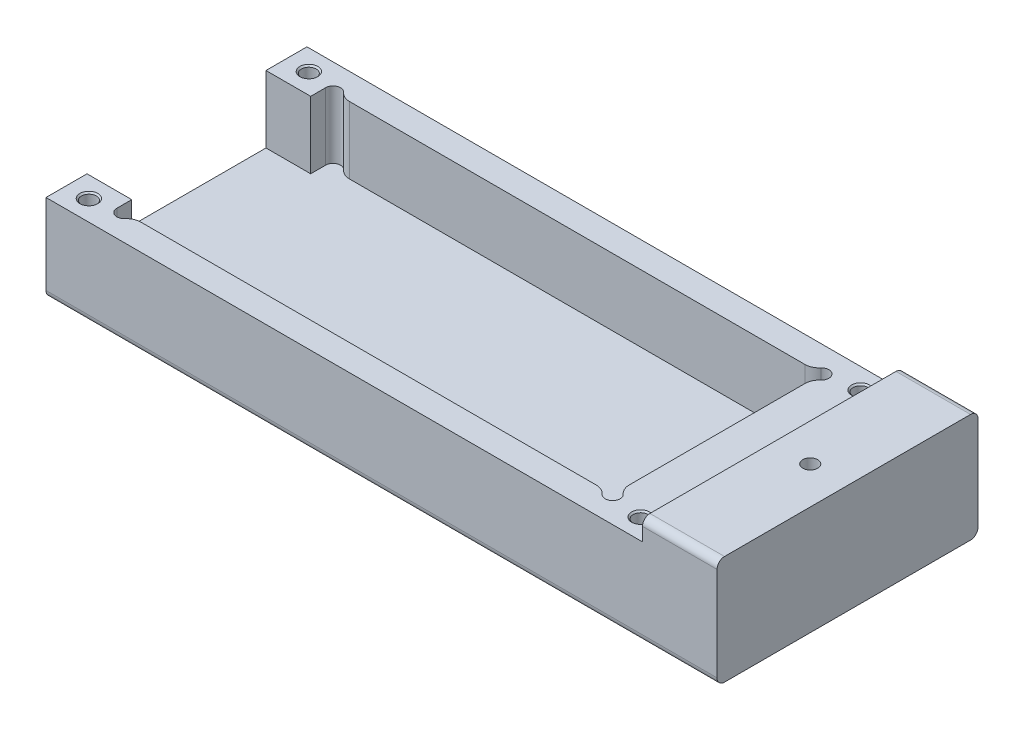
from build123d import *

# Parameters (mm, degrees)
SKETCH_1_W                 = 45
SKETCH_1_H                 = 17.5
EXTRUDE_2_DEPTH            = 5.9
CUT_EXTRUDE_1_DEPTH        = 10
CUT_EXTRUDE_1_DEPTH_BACK   = 2.4
FILLET_1_R                 = 1
FILLET_2_R                 = 1
FILLET_5_R                 = 1
FILLET_6_R                 = 1
FILLET_7_R                 = 0.5
SKETCH_5_R                 = 0.5
CUT_EXTRUDE_2_DEPTH        = 4.5
CHAMFER_1_SIZE             = 0.1
CHAMFER_1_OF_MIRROR_1_SIZE = 0.1
SKETCH_20_W                = 5
SKETCH_20_H                = 17.5
EXTRUDE_3_DEPTH            = 1.4
FILLET_8_R                 = 0.5
SKETCH_21_R                = 0.5
CUT_EXTRUDE_3_DEPTH        = 11


# Read off the part's stored shape, not the designer's step: 镜向2
with BuildPart() as part:
    # 草图1 → 凸台-拉伸2 (new body)
    with BuildSketch(Plane(origin=(0, 0, 0), x_dir=(1, 0, 0), z_dir=(0, 1, 0))):
        with Locations((2.5, 0)):
            Rectangle(SKETCH_1_W, SKETCH_1_H)
    extrude(amount=EXTRUDE_2_DEPTH)

    # 草图3 → 切除-拉伸1 (cut, two sides: drawn at the far end of the back side and taken through both)
    with BuildSketch(Plane(origin=(0, 3.8, 0), x_dir=(1, 0, 0), z_dir=(0, 1, 0)).offset(-CUT_EXTRUDE_1_DEPTH_BACK)):
        with BuildLine():
            Line((-17, -6.5), (-17, -7))
            ThreePointArc((-17, -7), (-16.5, -7.5), (-16, -7))
            Line((-16, -7), (15.751729614, -7))
            ThreePointArc((15.751729614, -7), (16.605283005, -7.353553391), (16.251729614, -6.5))
            Line((16.251729614, -6.5), (16.251729614, 6.5))
            ThreePointArc((16.251729614, 6.5), (16.605283005, 7.353553391), (15.751729614, 7))
            Line((15.751729614, 7), (-16, 7))
            ThreePointArc((-16, 7), (-16.5, 7.5), (-17, 7))
            Line((-17, 7), (-17, 6.5))
            Line((-17, 6.5), (-17, 6))
            Line((-17, 6), (-20, 6))
            Line((-20, 6), (-20, -6))
            Line((-20, -6), (-17, -6))
            Line((-17, -6), (-17, -6.5))
        make_face()
    extrude(amount=CUT_EXTRUDE_1_DEPTH + CUT_EXTRUDE_1_DEPTH_BACK, mode=Mode.SUBTRACT)

    # 圆角1
    fillet_1_edges = [part.edges().sort_by_distance(p)[0] for p in [
        (16.251729614, 3.65, -6.5),
    ]]
    fillet(fillet_1_edges, radius=FILLET_1_R)

    # 圆角2
    fillet_2_edges = [part.edges().sort_by_distance(p)[0] for p in [
        (15.751729614, 3.65, -7),
    ]]
    fillet(fillet_2_edges, radius=FILLET_2_R)

    # 圆角5
    fillet_5_edges = [part.edges().sort_by_distance(p)[0] for p in [
        (-16, 3.65, 7),
        (-16, 3.65, -7),
    ]]
    fillet(fillet_5_edges, radius=FILLET_5_R)

    # 圆角6
    fillet_6_edges = [part.edges().sort_by_distance(p)[0] for p in [
        (15.751729614, 3.65, 7),
        (16.251729614, 3.65, 6.5),
    ]]
    fillet(fillet_6_edges, radius=FILLET_6_R)

    # 圆角7
    fillet_7_edges = [part.edges().sort_by_distance(p)[0] for p in [
        (2.5, 0, -8.75),
        (2.5, 0, 8.75),
    ]]
    fillet(fillet_7_edges, radius=FILLET_7_R)

    # 草图5 → 切除-拉伸2 (cut)
    with BuildSketch(Plane(origin=(0, 5.9, 0), x_dir=(1, 0, 0), z_dir=(0, 1, 0))):
        with Locations(Location((-18.5, 7.375, 0), (0, 0, 270))):
            Circle(SKETCH_5_R)
    cut_extrude_2 = extrude(amount=-CUT_EXTRUDE_2_DEPTH, mode=Mode.SUBTRACT)

    # 倒角1
    chamfer_1_edges = [part.edges().sort_by_distance(p)[0] for p in [
        (-18.5, 5.9, -7.875),
    ]]
    chamfer(chamfer_1_edges, length=CHAMFER_1_SIZE)

    # 镜向1: 切除-拉伸2 across plane
    add(cut_extrude_2.mirror(Plane.XY), mode=Mode.SUBTRACT)

    # 倒角1 of 镜向1
    chamfer_1_of_mirror_1_edges = [part.edges().sort_by_distance(p)[0] for p in [
        (-18.5, 5.9, 7.875),
    ]]
    chamfer(chamfer_1_of_mirror_1_edges, length=CHAMFER_1_OF_MIRROR_1_SIZE)

    # 镜向2 outline → 镜向2 (revolve, cut)
    with BuildSketch(Plane(origin=(18.5, 0, -7.375), x_dir=(1, 0, 0), z_dir=(0, 0, 1))):
        Polygon((0, 5.9), (0, 1.4), (0.5, 1.4), (0.5, 5.8), (0.6, 5.9), align=None)
    revolve(axis=Axis((18.5, 0, -7.375), (0, 1, 0)), mode=Mode.SUBTRACT)

    # Mirror 2 2 outline → Mirror 2 2 (revolve, cut)
    with BuildSketch(Plane(origin=(18.5, 0, 7.375), x_dir=(1, 0, 0), z_dir=(0, 0, 1))):
        Polygon((0, 5.9), (0, 1.4), (0.5, 1.4), (0.5, 5.8), (0.6, 5.9), align=None)
    revolve(axis=Axis((18.5, 0, 7.375), (0, 1, 0)), mode=Mode.SUBTRACT)

    # 草图20 → 凸台-拉伸3 (add)
    with BuildSketch(Plane(origin=(0, 5.9, 0), x_dir=(1, 0, 0), z_dir=(0, 1, 0))):
        with Locations((22.5, 0)):
            Rectangle(SKETCH_20_W, SKETCH_20_H)
    extrude(amount=EXTRUDE_3_DEPTH)

    # 圆角8
    fillet_8_edges = [part.edges().sort_by_distance(p)[0] for p in [
        (22.5, 7.3, 8.75),
        (22.5, 7.3, -8.75),
    ]]
    fillet(fillet_8_edges, radius=FILLET_8_R)

    # 草图21 → 切除-拉伸3 (cut)
    with BuildSketch(Plane(origin=(0, 0, 0), x_dir=(1, 0, 0), z_dir=(0, 1, 0))):
        with Locations(Location((22.5, 0, 0), (0, 0, 270))):
            Circle(SKETCH_21_R)
    extrude(amount=CUT_EXTRUDE_3_DEPTH, mode=Mode.SUBTRACT)


solid = part.part
